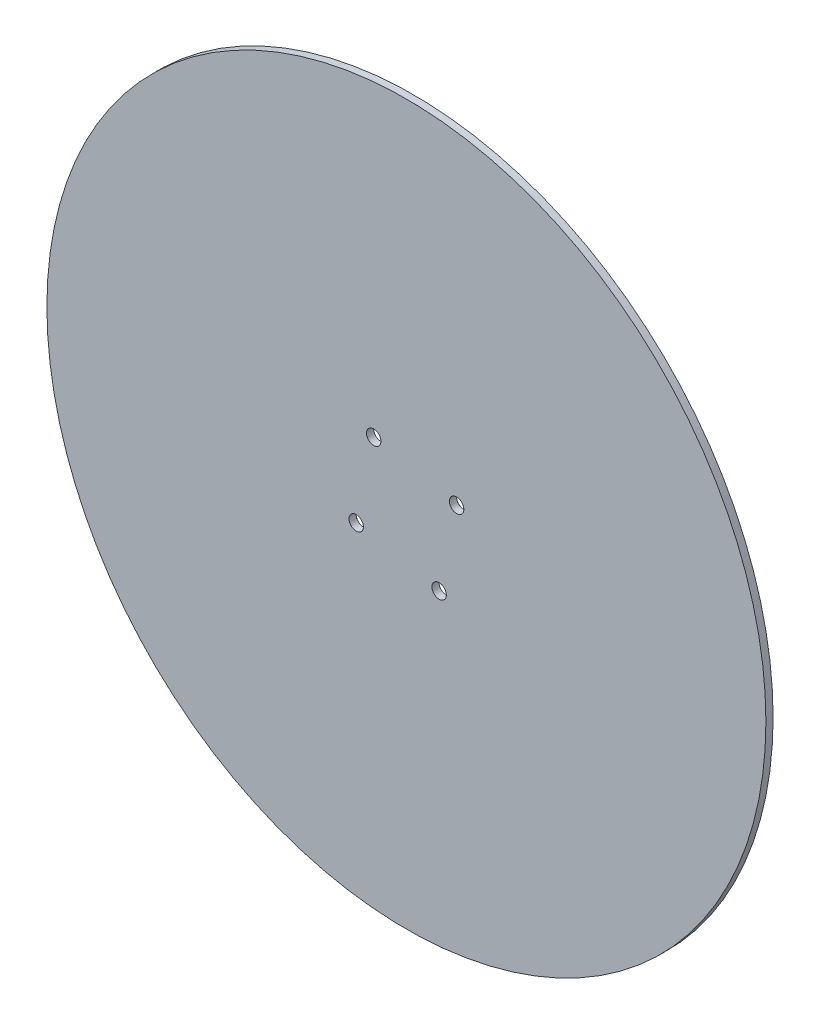
from build123d import *

# Parameters (mm, degrees)
SKETCH1_R                      = 150
BOSS_EXTRUDE2_DEPTH            = 3
F_6_0MM_DOWEL_HOLE1_AT_2_COUNT = 2
F_6_0MM_DOWEL_HOLE1_AT_2_PITCH = 35.355339059
F_6_0MM_DOWEL_HOLE1_AT_3_COUNT = 2
F_6_0MM_DOWEL_HOLE1_AT_3_PITCH = 50
F_6_0MM_DOWEL_HOLE1_AT_4_COUNT = 2
F_6_0MM_DOWEL_HOLE1_AT_4_PITCH = 35.355339059


with BuildPart() as part:
    # Sketch1 → Boss-Extrude2 (new body)
    with BuildSketch(Plane.XY):
        Circle(SKETCH1_R)
    extrude(amount=BOSS_EXTRUDE2_DEPTH)

    # Sketch9 → Ø6.0mm Dowel Hole1 (revolve, cut)
    with BuildSketch(Plane(origin=(20.948618644, 13.643876902, 0), x_dir=(0, 1, 0), z_dir=(1, 0, 0))):
        Polygon((0, 0), (0, 3), (3, 3), (3, 0.025), (3.025, 0), align=None)
    f_6_0mm_dowel_hole1 = revolve(axis=Axis((20.948618644, 13.643876902, -6.35), (0, 0, 1)), mode=Mode.SUBTRACT)

    # Ø6.0mm Dowel Hole1 at 2: Ø6.0mm Dowel Hole1 ×2
    with Locations(*[Vector(-0.978423527146206, 0.20660929680626103, 0) * (i * F_6_0MM_DOWEL_HOLE1_AT_2_PITCH) for i in range(1, F_6_0MM_DOWEL_HOLE1_AT_2_COUNT)]):
        add(f_6_0mm_dowel_hole1, mode=Mode.SUBTRACT)

    # Ø6.0mm Dowel Hole1 at 3: Ø6.0mm Dowel Hole1 ×2
    with Locations(*[Vector(-0.8379447457454335, -0.5457550760896511, 0) * (i * F_6_0MM_DOWEL_HOLE1_AT_3_PITCH) for i in range(1, F_6_0MM_DOWEL_HOLE1_AT_3_COUNT)]):
        add(f_6_0mm_dowel_hole1, mode=Mode.SUBTRACT)

    # Ø6.0mm Dowel Hole1 at 4: Ø6.0mm Dowel Hole1 ×2
    with Locations(*[Vector(-0.20660929680626103, -0.978423527146206, 0) * (i * F_6_0MM_DOWEL_HOLE1_AT_4_PITCH) for i in range(1, F_6_0MM_DOWEL_HOLE1_AT_4_COUNT)]):
        add(f_6_0mm_dowel_hole1, mode=Mode.SUBTRACT)


solid = part.part
